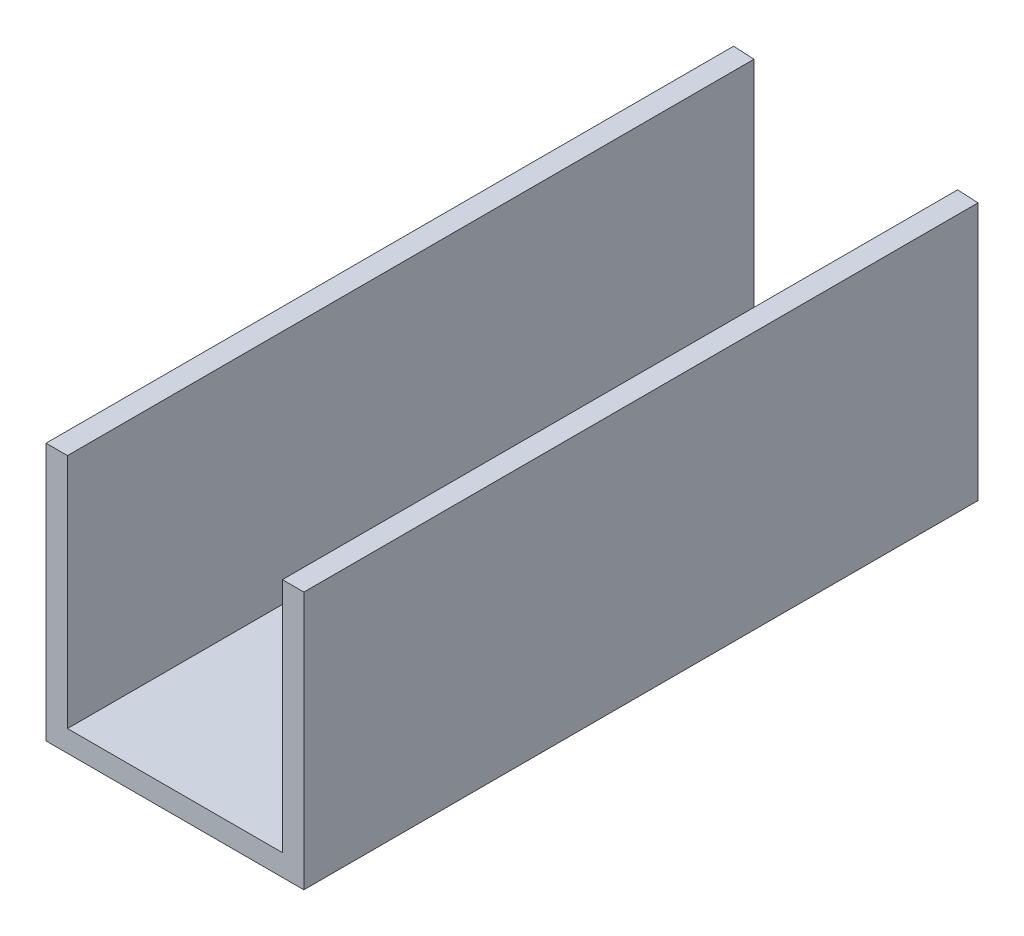
from build123d import *

# Parameters (mm, degrees)
BOSS_EXTRUDE1_DEPTH = 101.6
CUT_EXTRUDE1_DEPTH  = 98.425


with BuildPart() as part:
    # Sketch1 → Boss-Extrude1 (new body)
    with BuildSketch(Plane.XY):
        Polygon((18.371241491, 0), (-19.728758509, 0), (-19.728758509, 38.1), (-16.553758509, 38.1), (-16.553758509, 3.175), (15.196241491, 3.175), (15.196241491, 38.1), (18.371241491, 38.1), align=None)
    extrude(amount=BOSS_EXTRUDE1_DEPTH)

    # Sketch2 → Cut-Extrude1 (cut)
    with BuildSketch(Plane(origin=(0, 38.1, 0), x_dir=(1, 0, 0), z_dir=(0, 1, 0))):
        Polygon((-19.728758509, 0), (18.371241491, 0), (18.371241491, -1.996736391), align=None)
    extrude(amount=-CUT_EXTRUDE1_DEPTH, mode=Mode.SUBTRACT)


solid = part.part
